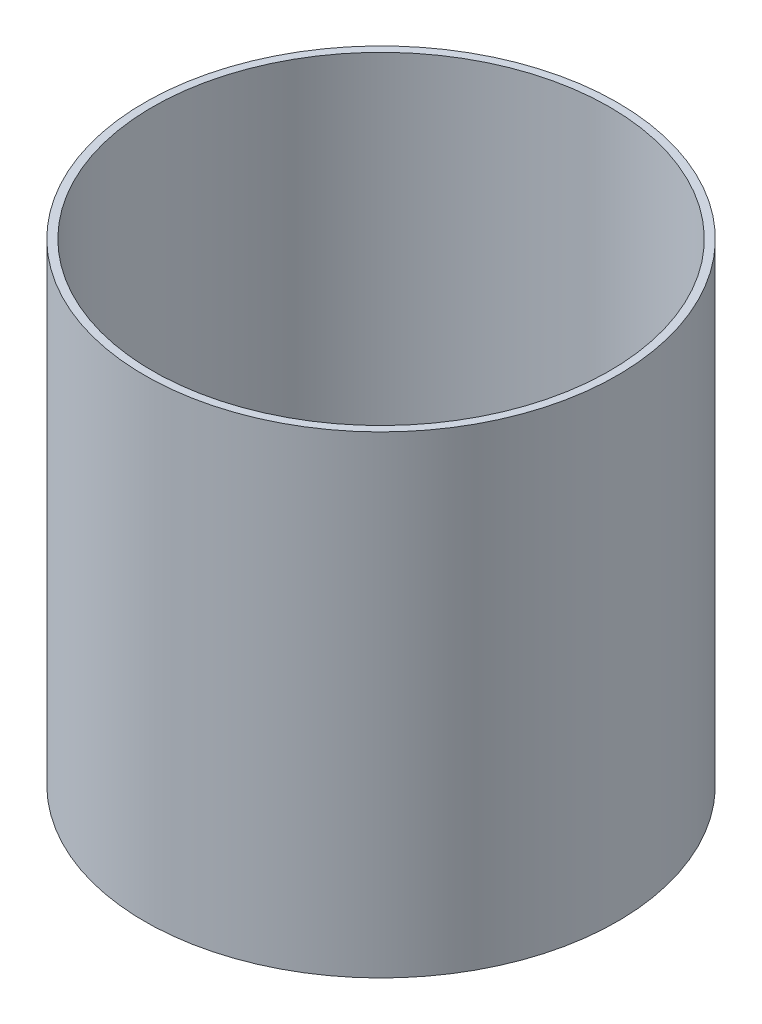
from build123d import *

# Parameters (mm, degrees)
SKETCH1_R           = 76.1746
SKETCH1_R_2         = 73.66
BOSS_EXTRUDE1_DEPTH = 152.4


with BuildPart() as part:
    # Sketch1 → Boss-Extrude1 (new body)
    with BuildSketch(Plane(origin=(0, 0, 0), x_dir=(1, 0, 0), z_dir=(0, 1, 0))):
        Circle(SKETCH1_R)
        Circle(SKETCH1_R_2, mode=Mode.SUBTRACT)
    extrude(amount=BOSS_EXTRUDE1_DEPTH)


solid = part.part
